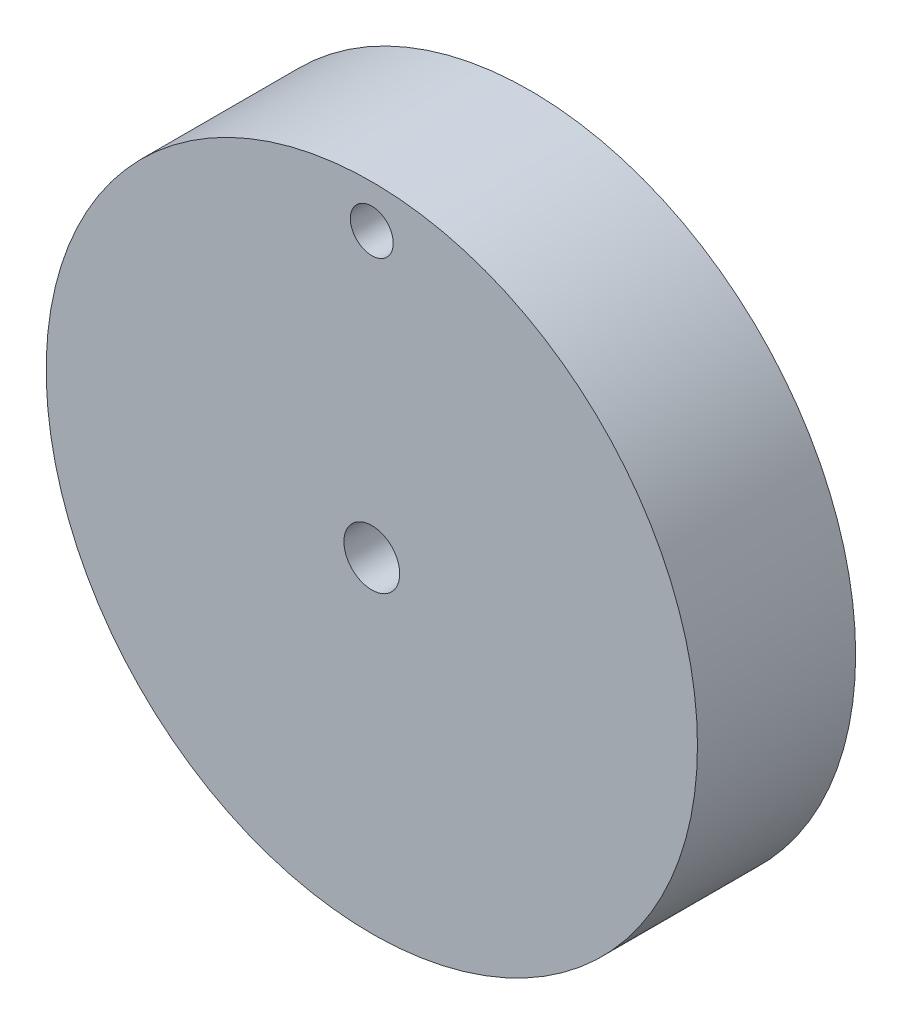
from build123d import *

# Parameters (mm, degrees)
SKETCH1_R           = 18
BOSS_EXTRUDE1_DEPTH = 20
SKETCH2_R           = 3
CUT_EXTRUDE1_DEPTH  = 60
SKETCH4_R           = 35
SKETCH4_R_2         = 14.576002813
BOSS_EXTRUDE2_DEPTH = 17
SKETCH5_R           = 2.304224671
CUT_EXTRUDE2_DEPTH  = 4


with BuildPart() as part:
    # Sketch1 → Boss-Extrude1 (new body)
    with BuildSketch(Plane.XY):
        Circle(SKETCH1_R)
    extrude(amount=BOSS_EXTRUDE1_DEPTH)

    # Sketch2 → Cut-Extrude1 (cut)
    with BuildSketch(Plane.XY.offset(20)):
        Circle(SKETCH2_R)
    extrude(amount=-CUT_EXTRUDE1_DEPTH, mode=Mode.SUBTRACT)

    # Sketch4 → Boss-Extrude2 (add)
    with BuildSketch(Plane.XY.offset(20)):
        Circle(SKETCH4_R)
        Circle(SKETCH4_R_2, mode=Mode.SUBTRACT)
    extrude(amount=-BOSS_EXTRUDE2_DEPTH)

    # Sketch5 → Cut-Extrude2 (cut)
    with BuildSketch(Plane.XY.offset(20)):
        with Locations((0, 30.420062281)):
            Circle(SKETCH5_R)
    extrude(amount=-CUT_EXTRUDE2_DEPTH, mode=Mode.SUBTRACT)


solid = part.part
